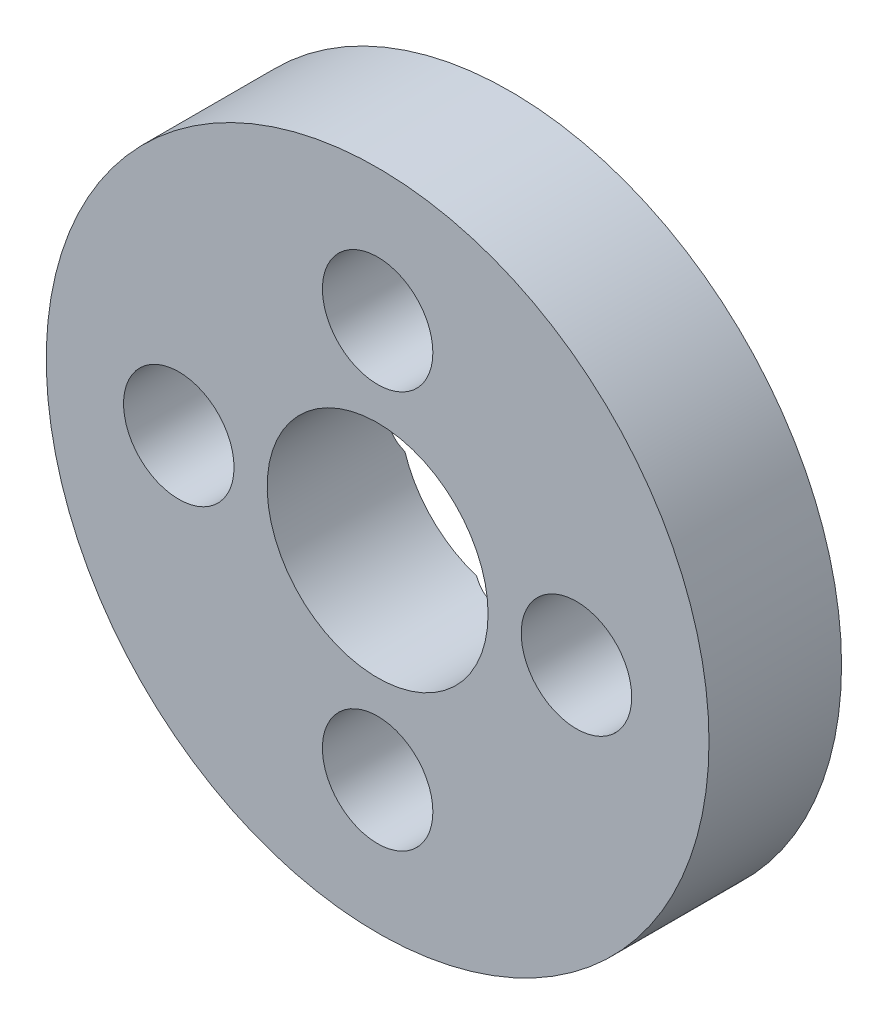
from build123d import *

# Parameters (mm, degrees)
SKETCH_1_R          = 7.5
SKETCH_1_R_2        = 2.5
EXTRUDE_1_DEPTH     = 3
SKETCH_2_R          = 1.25
CUT_EXTRUDE_1_DEPTH = 10
CHAMFER_1_SIZE      = 1


with BuildPart() as part:
    # 草图1 → 凸台-拉伸1 (new body)
    with BuildSketch(Plane.XY):
        Circle(SKETCH_1_R)
        Circle(SKETCH_1_R_2, mode=Mode.SUBTRACT)
    extrude(amount=EXTRUDE_1_DEPTH)

    # 草图2 → 切除-拉伸1 (cut)
    with BuildSketch(Plane.XY.offset(3)):
        with Locations((0, 4.5)):
            Circle(SKETCH_2_R)
        with Locations((4.5, 0)):
            Circle(SKETCH_2_R)
        with Locations((0, -4.5)):
            Circle(SKETCH_2_R)
        with Locations((-4.5, 0)):
            Circle(SKETCH_2_R)
    extrude(amount=-CUT_EXTRUDE_1_DEPTH, mode=Mode.SUBTRACT)

    # 倒角1
    # the kernel refuses this chamfer: 1 mm, written as the material it takes off along each edge
    with BuildSketch(Plane(origin=(0, 4.5, 0), x_dir=(1, 0, 0), z_dir=(0, -1, 0))) as chamfer_1_piece_1:
        Polygon((1.25 + CHAMFER_1_SIZE, 0), (1.25, CHAMFER_1_SIZE), (1.25, 0), align=None)
    revolve(axis=Axis((0, 4.5, 0), (0, 0, 1)), mode=Mode.SUBTRACT)
    with BuildSketch(Plane(origin=(4.5, 0, 0), x_dir=(1, 0, 0), z_dir=(0, -1, 0))) as chamfer_1_piece_2:
        Polygon((1.25 + CHAMFER_1_SIZE, 0), (1.25, CHAMFER_1_SIZE), (1.25, 0), align=None)
    revolve(axis=Axis((4.5, 0, 0), (0, 0, 1)), mode=Mode.SUBTRACT)
    with BuildSketch(Plane(origin=(0, -4.5, 0), x_dir=(1, 0, 0), z_dir=(0, -1, 0))) as chamfer_1_piece_3:
        Polygon((1.25 + CHAMFER_1_SIZE, 0), (1.25, CHAMFER_1_SIZE), (1.25, 0), align=None)
    revolve(axis=Axis((0, -4.5, 0), (0, 0, 1)), mode=Mode.SUBTRACT)
    with BuildSketch(Plane(origin=(-4.5, 0, 0), x_dir=(1, 0, 0), z_dir=(0, -1, 0))) as chamfer_1_piece_4:
        Polygon((1.25 + CHAMFER_1_SIZE, 0), (1.25, CHAMFER_1_SIZE), (1.25, 0), align=None)
    revolve(axis=Axis((-4.5, 0, 0), (0, 0, 1)), mode=Mode.SUBTRACT)


solid = part.part
